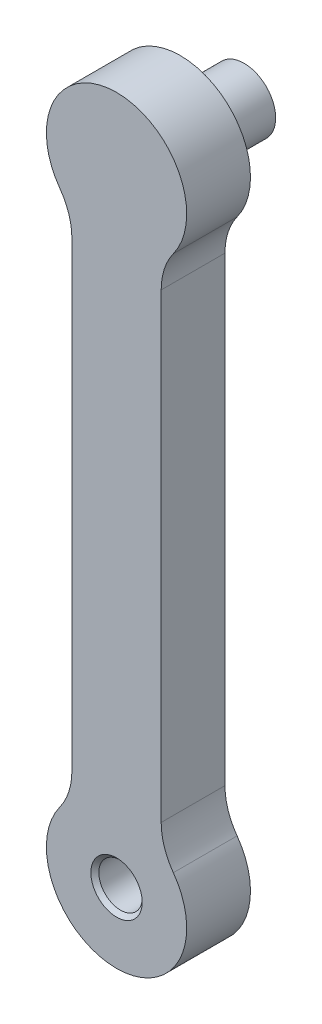
from build123d import *

# Parameters (mm, degrees)
BOSS_EXTRU_2_DEPTH          = 10
ESQUISSE2_R                 = 4.95
BOSS_EXTRU_3_DEPTH          = 10
CONG_1_R                    = 10
TROU_TARAUD_M81_D           = 6.8
TROU_TARAUD_M81_CSINK_D     = 8.05
TROU_TARAUD_M81_CSINK_ANGLE = 90


with BuildPart() as part:
    # Esquisse1 → Boss.-Extru.2 (new body)
    with BuildSketch(Plane.XY):
        with BuildLine():
            Line((-7, 40), (-7, -40))
            ThreePointArc((-7, -40), (0, -59.485281374), (7, -40))
            Line((7, -40), (7, 40))
            ThreePointArc((7, 40), (0, 59.485281374), (-7, 40))
        make_face()
    extrude(amount=BOSS_EXTRU_2_DEPTH)

    # Esquisse2 → Boss.-Extru.3 (add)
    with BuildSketch(Plane(origin=(0, 0, 0), x_dir=(-1, 0, 0), z_dir=(0, 0, -1))):
        with Locations((0, 48.485281374)):
            Circle(ESQUISSE2_R)
    extrude(amount=BOSS_EXTRU_3_DEPTH)

    # Congé1
    cong_1_edges = [part.edges().sort_by_distance(p)[0] for p in [
        (7, 40, 5),
        (7, -40, 5),
        (-7, -40, 5),
        (-7, 40, 5),
    ]]
    fillet(cong_1_edges, radius=CONG_1_R)

    # Trou taraudé M81 (through all)
    with Locations(Plane.XY.offset(10)):
        with Locations((0, -48.485281374)):
            CounterSinkHole(TROU_TARAUD_M81_D / 2, TROU_TARAUD_M81_CSINK_D / 2, counter_sink_angle=TROU_TARAUD_M81_CSINK_ANGLE)


solid = part.part
